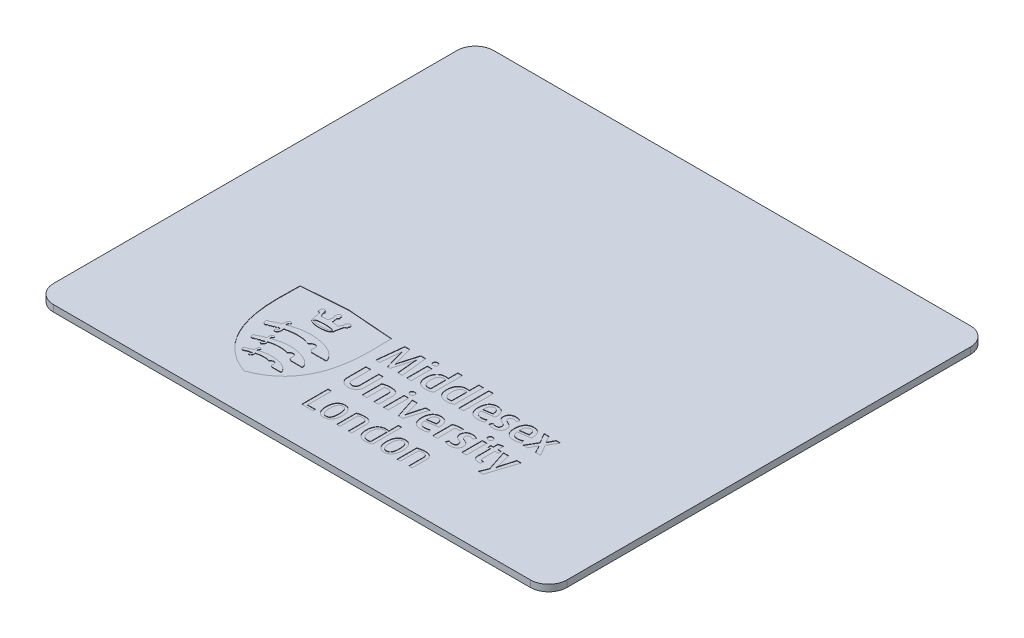
from build123d import *

# Parameters (mm, degrees)
SKETCH1_W           = 1400
SKETCH1_H           = 1200
BOSS_EXTRUDE1_DEPTH = 18
SKETCH2_R           = 5
CUT_EXTRUDE1_DEPTH  = 1
FILLET1_R           = 50
SKETCH3_W           = 12.711219773
SKETCH3_H           = 56.157817778
SKETCH3_W_2         = 12.7036033
SKETCH3_H_2         = 81.790382994
SKETCH3_W_3         = 12.708083578
SKETCH3_H_3         = 56.155353625
SKETCH3_W_4         = 12.712339843
CUT_EXTRUDE3_DEPTH  = 1
SKETCH4_R           = 50
BOSS_EXTRUDE2_DEPTH = 22


with BuildPart() as part:
    # Sketch1 → Boss-Extrude1 (new body)
    with BuildSketch(Plane(origin=(0, 0, 0), x_dir=(1, 0, 0), z_dir=(0, 1, 0))):
        Rectangle(SKETCH1_W, SKETCH1_H)
    extrude(amount=BOSS_EXTRUDE1_DEPTH)

    # Sketch2 → Cut-Extrude1 (cut)
    with BuildSketch(Plane.XZ):
        Circle(SKETCH2_R)
    extrude(amount=-CUT_EXTRUDE1_DEPTH, mode=Mode.SUBTRACT)

    # Fillet1
    fillet1_edges = [part.edges().sort_by_distance(p)[0] for p in [
        (700, 9, -600),
        (700, 9, 600),
        (-700, 9, 600),
        (-700, 9, -600),
    ]]
    fillet(fillet1_edges, radius=FILLET1_R)

    # Sketch3 → Cut-Extrude3 (cut)
    # profile 1 of 30: a face of its own
    with BuildSketch(Plane(origin=(0, 18, 0), x_dir=(1, 0, 0), z_dir=(0, 1, 0))):
        with BuildLine():
            add(Edge.make_bspline(
                [(-233.972341878, -496.795322485), (-108.060858563, -451.574758816), (-108.060858563, -246.693896228), (-108.93697686, -219.688573902)],
                knots=[4, 4, 4, 5, 5.195198766, 5.195198766, 5.195198766], degree=2))
            Line((-108.93697686, -219.688573902), (-234.732644998, -210.062025057))
            Line((-234.732644998, -210.062025057), (-358.213574782, -219.257571179))
            add(Edge.make_bspline(
                [(-358.213574782, -219.257571179), (-359.084316768, -246.258637242), (-359.084316768, -451.13949983), (-233.972341878, -496.795322485)],
                knots=[2, 2, 2, 3, 8.122573303, 8.122573303, 8.122573303], degree=2))
        make_face()
        with BuildLine():
            Line((-231.871091654, -424.034491323), (-231.323153696, -424.0389716))
            add(Edge.make_bspline(
                [(-180.634636295, -448.741655164), (-180.634636295, -443.683869582), (-189.738336493, -425.005815545), (-231.323153696, -424.0389716)],
                knots=[48, 48, 48, 48, 49, 49, 49, 49], degree=3))
            Line((-180.634636295, -448.741655164), (-180.634636295, -449.454915386))
            Line((-180.634636295, -449.454915386), (-205.346055775, -449.454915386))
            Line((-205.346055775, -449.454915386), (-210.028611333, -445.66594447))
            add(Edge.make_bspline(
                [(-212.763155447, -434.21592257), (-209.368001034, -436.007585653), (-208.326784505, -440.861966624), (-210.028611333, -445.66594447)],
                knots=[44, 44, 44, 44, 45, 45, 45, 45], degree=3))
            add(Edge.make_bspline(
                [(-223.86774765, -438.56044793), (-220.856329019, -434.342714431), (-216.196840249, -432.402306126), (-212.763155447, -434.21592257)],
                knots=[43, 43, 43, 43, 44, 44, 44, 44], degree=3))
            add(Edge.make_bspline(
                [(-223.86774765, -438.56044793), (-226.087053191, -437.781775653), (-231.272750572, -436.3115725), (-245.970525461, -436.3115725), (-253.249851044, -437.366005875), (-260.84414589, -439.439926458)],
                knots=[42, 42, 42, 42, 43, 43, 43.855672144, 43.855672144, 43.855672144, 43.855672144], degree=3))
            add(Edge.make_bspline(
                [(-260.485499654, -445.609044942), (-259.974523973, -443.528627957), (-260.075330223, -441.697538429), (-260.84414589, -439.439926458)],
                knots=[40, 40, 40, 40, 41, 41, 41, 41], degree=3))
            add(Edge.make_bspline(
                [(-264.037015847, -450.71499351), (-263.585403847, -450.443712691), (-261.302478306, -448.921090289), (-260.485499654, -445.609044942)],
                knots=[39, 39, 39, 39, 40, 40, 40, 40], degree=3))
            Line((-264.037015847, -450.71499351), (-264.276710708, -450.811319483))
            add(Edge.make_bspline(
                [(-264.276710708, -450.811319483), (-264.746915861, -451.051910399), (-265.203008139, -451.174445996), (-267.340324652, -451.174445996), (-268.70546529, -449.855228205), (-268.70546529, -446.650485511), (-267.362278013, -445.359717484), (-265.706143333, -445.337764123)],
                knots=[37, 37, 37, 37, 38, 38, 41.606953163, 41.606953163, 45.208867274, 45.208867274, 45.208867274, 45.208867274], degree=3))
            add(Edge.make_bspline(
                [(-265.460176083, -441.590459791), (-265.025813152, -443.447758943), (-265.345256958, -444.646457262), (-265.706143333, -445.337764123)],
                knots=[34, 34, 34, 34, 35, 35, 35, 35], degree=3))
            add(Edge.make_bspline(
                [(-266.021330874, -441.887950235), (-265.825542736, -441.806857207), (-265.638491138, -441.706274971), (-265.460176083, -441.590459791)],
                knots=[33, 33, 33, 33, 34, 34, 34, 34], degree=3))
            add(Edge.make_bspline(
                [(-268.901253429, -441.675585068), (-267.945386166, -442.152510638), (-266.929035152, -442.237859929), (-266.021330874, -441.887950235)],
                knots=[32, 32, 32, 32, 33, 33, 33, 33], degree=3))
            add(Edge.make_bspline(
                [(-270.788122415, -443.670876776), (-269.931717318, -443.338216151), (-269.278716832, -442.642653026), (-268.901253429, -441.675585068)],
                knots=[31, 31, 31, 31, 32, 32, 32, 32], degree=3))
            add(Edge.make_bspline(
                [(-273.677901581, -443.36464979), (-272.712177706, -443.909227554), (-271.678577623, -444.031763151), (-270.788122415, -443.670876776)],
                knots=[30, 30, 30, 30, 31, 31, 31, 31], degree=3))
            add(Edge.make_bspline(
                [(-275.547297483, -445.445066776), (-274.682155844, -445.119126567), (-274.028035289, -444.381896859), (-273.677901581, -443.36464979)],
                knots=[29, 29, 29, 29, 30, 30, 30, 30], degree=3))
            add(Edge.make_bspline(
                [(-278.456789871, -445.092692929), (-277.491065997, -445.66594447), (-276.434392483, -445.792736331), (-275.547297483, -445.445066776)],
                knots=[28, 28, 28, 28, 29, 29, 29, 29], degree=3))
            add(Edge.make_bspline(
                [(-280.304232413, -447.236729859), (-279.426097968, -446.895332692), (-278.780713955, -446.12965322), (-278.456789871, -445.092692929)],
                knots=[27, 27, 27, 27, 28, 28, 28, 28], degree=3))
            add(Edge.make_bspline(
                [(-283.225821551, -446.829696623), (-282.274210551, -447.437894331), (-281.20790444, -447.591119831), (-280.304232413, -447.236729859)],
                knots=[26, 26, 26, 26, 27, 27, 27, 27], degree=3))
            add(Edge.make_bspline(
                [(-285.052654814, -449.017416261), (-284.161079537, -448.663026289), (-283.524432064, -447.879873733), (-283.225821551, -446.829696623)],
                knots=[25, 25, 25, 25, 26, 26, 26, 26], degree=3))
            add(Edge.make_bspline(
                [(-290.122537146, -445.889062303), (-289.18839923, -448.304156039), (-286.901217425, -449.739413025), (-285.052654814, -449.017416261)],
                knots=[24, 24, 24, 24, 25, 25, 25, 25], degree=3))
            add(Edge.make_bspline(
                [(-290.171596188, -441.842027388), (-290.686828132, -443.00577954), (-290.66711491, -444.482479095), (-290.122537146, -445.889062303)],
                knots=[23, 23, 23, 23, 24, 24, 24, 24], degree=3))
            add(Edge.make_bspline(
                [(-288.486115688, -440.168419624), (-289.22760166, -440.450677124), (-289.808469674, -441.02818493), (-290.171596188, -441.842027388)],
                knots=[22, 22, 22, 22, 23, 23, 23, 23], degree=3))
            add(Edge.make_bspline(
                [(-285.816094147, -440.470390346), (-286.711925689, -439.951798194), (-287.66129655, -439.851215958), (-288.486115688, -440.168419624)],
                knots=[21, 21, 21, 21, 22, 22, 22, 22], degree=3))
            add(Edge.make_bspline(
                [(-283.868965426, -438.026622833), (-284.841409717, -438.402966166), (-285.532716578, -439.295437499), (-285.816094147, -440.470390346)],
                knots=[20, 20, 20, 20, 21, 21, 21, 21], degree=3))
            add(Edge.make_bspline(
                [(-281.211040635, -438.27819043), (-282.110232384, -437.803505), (-283.043250231, -437.709419166), (-283.868965426, -438.026622833)],
                knots=[19, 19, 19, 19, 20, 20, 20, 20], degree=3))
            add(Edge.make_bspline(
                [(-279.242182566, -435.882809917), (-280.209250524, -436.256913111), (-280.900557385, -437.120934681), (-281.211040635, -438.27819043)],
                knots=[18, 18, 18, 18, 19, 19, 19, 19], degree=3))
            add(Edge.make_bspline(
                [(-276.613827608, -436.084198403), (-277.502042677, -435.639978861), (-278.446037205, -435.56560625), (-279.242182566, -435.882809917)],
                knots=[17, 17, 17, 17, 18, 18, 18, 18], degree=3))
            add(Edge.make_bspline(
                [(-274.620776039, -433.743253265), (-275.575747247, -434.110860056), (-276.272430441, -434.944415737), (-276.613827608, -436.084198403)],
                knots=[16, 16, 16, 16, 17, 17, 17, 17], degree=3))
            add(Edge.make_bspline(
                [(-272.013254373, -433.883261945), (-272.907965845, -433.478692862), (-273.8201504, -433.432770015), (-274.620776039, -433.743253265)],
                knots=[15, 15, 15, 15, 16, 16, 16, 16], degree=3))
            add(Edge.make_bspline(
                [(-270.00496986, -431.599440349), (-270.94224397, -431.964807001), (-271.639151179, -432.767672779), (-272.013254373, -433.883261945)],
                knots=[14, 14, 14, 14, 15, 15, 15, 15], degree=3))
            add(Edge.make_bspline(
                [(-269.949190401, -431.581967265), (-269.972039818, -431.581967265), (-269.988616846, -431.594960071), (-270.00496986, -431.599440349)],
                knots=[13, 13, 13, 13, 14, 14, 14, 14], degree=3))
            add(Edge.make_bspline(
                [(-267.867653346, -421.302193921), (-268.838977568, -422.170695768), (-271.769303248, -425.430321864), (-269.949190401, -431.581967265)],
                knots=[12, 12, 12, 12, 13, 13, 13, 13], degree=3))
            add(Edge.make_bspline(
                [(-267.553585874, -421.03315324), (-267.676121471, -421.129479212), (-267.786560318, -421.225581171), (-267.867653346, -421.302193921)],
                knots=[11, 11, 11, 11, 12, 12, 12, 12], degree=3))
            add(Edge.make_bspline(
                [(-267.168730013, -420.766352698), (-267.21465286, -420.788082046), (-267.353541471, -420.87992774), (-267.553585874, -421.03315324)],
                knots=[10, 10, 10, 10, 11, 11, 11, 11], degree=3))
            Line((-267.168730013, -420.766352698), (-266.990414958, -420.68749981))
            add(Edge.make_bspline(
                [(-266.595478472, -420.527777907), (-266.754080305, -420.589157712), (-266.908425874, -420.639336824), (-266.990414958, -420.68749981)],
                knots=[8, 8, 8, 8, 9, 9, 9, 9], degree=3))
            add(Edge.make_bspline(
                [(-266.059637249, -420.42943581), (-266.224735485, -420.44041249), (-266.397450194, -420.473118518), (-266.595478472, -420.527777907)],
                knots=[7, 7, 7, 7, 8, 8, 8, 8], degree=3))
            add(Edge.make_bspline(
                [(-266.059637249, -420.42943581), (-265.96980768, -420.394265629), (-265.836295402, -420.355063199), (-263.987732792, -420.355063199), (-262.619455959, -421.672040851), (-262.619455959, -424.760968364), (-263.775591639, -425.990356586), (-265.265508014, -426.180768392)],
                knots=[6, 6, 6, 6, 7, 7, 16.915343915, 16.915343915, 26.023608912, 26.023608912, 26.023608912, 26.023608912], degree=3))
            add(Edge.make_bspline(
                [(-265.002963736, -430.719961821), (-265.974287958, -428.153882724), (-265.683293916, -427.038293558), (-265.265508014, -426.180768392)],
                knots=[3, 3, 3, 3, 4, 4, 4, 4], degree=3))
            Line((-265.002963736, -430.719961821), (-264.112508528, -430.409478571))
            add(Edge.make_bspline(
                [(-231.871091654, -424.034491323), (-246.002111419, -424.034491323), (-256.467810557, -427.718623738), (-264.112508528, -430.409478571)],
                knots=[1, 1, 1, 1, 2, 2, 2, 2], degree=3))
        make_face(mode=Mode.SUBTRACT)
        with BuildLine():
            Line((-277.780939969, -373.161161183), (-277.534748705, -373.062595072))
            add(Edge.make_bspline(
                [(-277.049086594, -372.863670738), (-277.243754663, -372.931322933), (-277.425429927, -372.994942877), (-277.534748705, -373.062595072)],
                knots=[7, 7, 7, 7, 8, 8, 8, 8], degree=3))
            add(Edge.make_bspline(
                [(-276.476955122, -372.756368086), (-276.669607066, -372.769584905), (-276.853298455, -372.806771211), (-277.049086594, -372.863670738)],
                knots=[6, 6, 6, 6, 7, 7, 7, 7], degree=3))
            add(Edge.make_bspline(
                [(-275.995773289, -372.673258933), (-276.172968275, -372.673258933), (-276.323953636, -372.716941641), (-276.476955122, -372.756368086)],
                knots=[5, 5, 5, 5, 6, 6, 6, 6], degree=3))
            add(Edge.make_bspline(
                [(-275.995773289, -372.673258933), (-274.07933447, -372.673258933), (-272.521765901, -374.16967171), (-272.521765901, -377.718051709), (-273.878169997, -379.135611598), (-275.614053622, -379.319302987)],
                knots=[4, 4, 4, 4, 5, 5, 5.933357744, 5.933357744, 5.933357744, 5.933357744], degree=3))
            add(Edge.make_bspline(
                [(-275.374582775, -384.738198958), (-276.259437636, -382.125973), (-276.048192539, -380.395689722), (-275.614053622, -379.319302987)],
                knots=[2, 2, 2, 2, 3, 3, 3, 3], degree=3))
            add(Edge.make_bspline(
                [(-275.374582775, -384.738198958), (-266.899689333, -381.747613542), (-247.062145114, -375.399059932), (-230.861685097, -375.399059932), (-230.463388412, -375.40354021), (-230.061955534, -375.414292877)],
                knots=[1, 1, 1, 1, 2, 2, 2.025408709, 2.025408709, 2.025408709, 2.025408709], degree=3))
            add(Edge.make_bspline(
                [(-162.717781905, -408.115168327), (-162.717781905, -403.050886342), (-174.420491175, -376.947891959), (-230.061955534, -375.414292877)],
                knots=[48, 48, 48, 48, 49, 49, 49, 49], degree=3))
            Line((-162.717781905, -408.115168327), (-162.717781905, -408.830444674))
            Line((-162.717781905, -408.830444674), (-195.358396794, -408.830444674))
            Line((-195.358396794, -408.830444674), (-201.559325094, -403.398555897))
            add(Edge.make_bspline(
                [(-204.542069949, -389.237965942), (-200.384596291, -391.432181984), (-199.233836973, -397.51617519), (-201.559325094, -403.398555897)],
                knots=[44, 44, 44, 44, 45, 45, 45, 45], degree=3))
            add(Edge.make_bspline(
                [(-218.128511963, -395.065911274), (-214.595364998, -389.612069137), (-208.782876771, -386.99357079), (-204.542069949, -389.237965942)],
                knots=[43, 43, 43, 43, 44, 44, 44, 44], degree=3))
            add(Edge.make_bspline(
                [(-218.128511963, -395.065911274), (-220.728417091, -394.042167802), (-228.760434872, -391.316366803), (-250.631128684, -391.316366803), (-260.348627168, -392.733926692), (-270.33852654, -395.529620024)],
                knots=[42, 42, 42, 42, 43, 43, 43.723862893, 43.723862893, 43.723862893, 43.723862893], degree=3))
            add(Edge.make_bspline(
                [(-269.988616846, -402.464417981), (-269.424101846, -400.178356245), (-269.530284429, -398.071729635), (-270.33852654, -395.529620024)],
                knots=[40, 40, 40, 40, 41, 41, 41, 41], degree=3))
            add(Edge.make_bspline(
                [(-274.151690956, -408.452085215), (-273.83336722, -408.268393827), (-270.982790484, -406.531390133), (-269.988616846, -402.464417981)],
                knots=[39, 39, 39, 39, 40, 40, 40, 40], degree=3))
            Line((-274.151690956, -408.452085215), (-274.374808789, -408.541690771))
            add(Edge.make_bspline(
                [(-274.374808789, -408.541690771), (-274.933723442, -408.830444674), (-275.458811997, -408.974933632), (-277.915348302, -408.974933632), (-279.476277079, -407.483001132), (-279.476277079, -403.801108856), (-277.915348302, -402.306936217), (-275.995773289, -402.306936217)],
                knots=[37, 37, 37, 37, 38, 38, 41.574885273, 41.574885273, 45.145423124, 45.145423124, 45.145423124, 45.145423124], degree=3))
            Line((-275.995773289, -402.306936217), (-275.949850441, -402.306936217))
            add(Edge.make_bspline(
                [(-275.485021622, -398.213978454), (-275.133767844, -400.154386759), (-275.481661414, -401.460387731), (-275.949850441, -402.306936217)],
                knots=[33, 33, 33, 33, 34, 34, 34, 34], degree=3))
            add(Edge.make_bspline(
                [(-276.442008955, -398.763036496), (-276.099715733, -398.627508093), (-275.781391997, -398.448072968), (-275.485021622, -398.213978454)],
                knots=[32, 32, 32, 32, 33, 33, 33, 33], degree=3))
            add(Edge.make_bspline(
                [(-280.07999451, -398.417383065), (-278.85822276, -399.069263482), (-277.56095833, -399.196279357), (-276.442008955, -398.763036496)],
                knots=[31, 31, 31, 31, 32, 32, 32, 32], degree=3))
            add(Edge.make_bspline(
                [(-282.446029204, -401.011911926), (-281.356649662, -400.591885884), (-280.52645419, -399.672980912), (-280.07999451, -398.417383065)],
                knots=[30, 30, 30, 30, 31, 31, 31, 31], degree=3))
            add(Edge.make_bspline(
                [(-286.102607911, -400.600622426), (-284.887332564, -401.300665828), (-283.569458856, -401.449411051), (-282.446029204, -401.011911926)],
                knots=[29, 29, 29, 29, 30, 30, 30, 30], degree=3))
            add(Edge.make_bspline(
                [(-288.445569174, -403.260787356), (-287.33759648, -402.829784634), (-286.517257619, -401.886910175), (-286.102607911, -400.600622426)],
                knots=[28, 28, 28, 28, 29, 29, 29, 29], degree=3))
            add(Edge.make_bspline(
                [(-292.179880701, -402.7598923), (-290.96034909, -403.523331633), (-289.590728174, -403.705006897), (-288.445569174, -403.260787356)],
                knots=[27, 27, 27, 27, 28, 28, 28, 28], degree=3))
            add(Edge.make_bspline(
                [(-294.441972951, -405.505406522), (-293.341616729, -405.0744038), (-292.550623687, -404.094343036), (-292.179880701, -402.7598923)],
                knots=[26, 26, 26, 26, 27, 27, 27, 27], degree=3))
            add(Edge.make_bspline(
                [(-298.199133894, -404.910201619), (-296.992595089, -405.721803938), (-295.614461645, -405.951642188), (-294.441972951, -405.505406522)],
                knots=[25, 25, 25, 25, 26, 26, 26, 26], degree=3))
            add(Edge.make_bspline(
                [(-300.448009324, -407.763018493), (-299.321443477, -407.316782827), (-298.527314241, -406.288559077), (-298.199133894, -404.910201619)],
                knots=[24, 24, 24, 24, 25, 25, 25, 25], degree=3))
            add(Edge.make_bspline(
                [(-306.588678045, -403.91714805), (-305.443519045, -406.866066883), (-302.671795199, -408.62054366), (-300.448009324, -407.763018493)],
                knots=[23, 23, 23, 23, 24, 24, 24, 24], degree=3))
            add(Edge.make_bspline(
                [(-306.652297989, -398.948968023), (-307.287825392, -400.373024315), (-307.257135489, -402.188880898), (-306.588678045, -403.91714805)],
                knots=[22, 22, 22, 22, 23, 23, 23, 23], degree=3))
            add(Edge.make_bspline(
                [(-304.631916726, -396.942923649), (-305.521251865, -397.284096802), (-306.217935059, -397.97988394), (-306.652297989, -398.948968023)],
                knots=[21, 21, 21, 21, 22, 22, 22, 22], degree=3))
            add(Edge.make_bspline(
                [(-301.197335782, -397.389159315), (-302.316285157, -396.695612316), (-303.574123143, -396.514161066), (-304.631916726, -396.942923649)],
                knots=[20, 20, 20, 20, 21, 21, 21, 21], degree=3))
            add(Edge.make_bspline(
                [(-298.806211533, -394.239076011), (-300.029103352, -394.709281163), (-300.883492324, -395.866536913), (-301.197335782, -397.389159315)],
                knots=[19, 19, 19, 19, 20, 20, 20, 20], degree=3))
            add(Edge.make_bspline(
                [(-295.44712327, -394.584729441), (-296.557336103, -393.969811316), (-297.757378505, -393.840779316), (-298.806211533, -394.239076011)],
                knots=[18, 18, 18, 18, 19, 19, 19, 19], degree=3))
            add(Edge.make_bspline(
                [(-292.972889868, -391.537244497), (-294.20227809, -392.005433525), (-295.075260214, -393.108029886), (-295.44712327, -394.584729441)],
                knots=[17, 17, 17, 17, 18, 18, 18, 18], degree=3))
            add(Edge.make_bspline(
                [(-289.658604382, -391.819501997), (-290.763440882, -391.252970873), (-291.957882937, -391.14566822), (-292.972889868, -391.537244497)],
                knots=[16, 16, 16, 16, 17, 17, 17, 17], degree=3))
            add(Edge.make_bspline(
                [(-287.158161355, -388.839893262), (-288.361339952, -389.30808229), (-289.25179516, -390.379988748), (-289.658604382, -391.819501997)],
                knots=[15, 15, 15, 15, 16, 16, 16, 16], degree=3))
            add(Edge.make_bspline(
                [(-283.852612412, -389.05001829), (-284.974921995, -388.524929734), (-286.155251175, -388.446076845), (-287.158161355, -388.839893262)],
                knots=[14, 14, 14, 14, 15, 15, 15, 15], degree=3))
            add(Edge.make_bspline(
                [(-281.335816371, -386.136045624), (-282.523762023, -386.604234651), (-283.412873148, -387.641194943), (-283.852612412, -389.05001829)],
                knots=[13, 13, 13, 13, 14, 14, 14, 14], degree=3))
            add(Edge.make_bspline(
                [(-280.922286732, -386.013510027), (-281.068791815, -386.044199929), (-281.202304093, -386.085642499), (-281.335816371, -386.136045624)],
                knots=[12, 12, 12, 12, 13, 13, 13, 13], degree=3))
            add(Edge.make_bspline(
                [(-278.510553205, -373.749645669), (-280.003605774, -375.079616127), (-283.117622842, -378.892780542), (-280.922286732, -386.013510027)],
                knots=[11, 11, 11, 11, 12, 12, 12, 12], degree=3))
            add(Edge.make_bspline(
                [(-278.182372857, -373.460891766), (-278.316781191, -373.56595428), (-278.446037205, -373.67079278), (-278.510553205, -373.749645669)],
                knots=[10, 10, 10, 10, 11, 11, 11, 11], degree=3))
            add(Edge.make_bspline(
                [(-277.780939969, -373.161161183), (-277.812525927, -373.185130669), (-277.965751427, -373.290193183), (-278.182372857, -373.460891766)],
                knots=[9, 9, 9, 9, 10, 10, 10, 10], degree=3))
        make_face(mode=Mode.SUBTRACT)
        with BuildLine():
            Line((-287.849468216, -317.47601271), (-287.603276952, -317.366469919))
            add(Edge.make_bspline(
                [(-286.980966369, -317.124758933), (-287.206324341, -317.188378877), (-287.408608883, -317.272608099), (-287.603276952, -317.366469919)],
                knots=[6, 6, 6, 6, 7, 7, 7, 7], degree=3))
            add(Edge.make_bspline(
                [(-286.315869133, -316.993486794), (-286.543467244, -317.018800363), (-286.750232064, -317.060242933), (-286.980966369, -317.124758933)],
                knots=[5, 5, 5, 5, 6, 6, 6, 6], degree=3))
            add(Edge.make_bspline(
                [(-285.751578147, -316.895144697), (-285.95162255, -316.895144697), (-286.111344453, -316.938827405), (-286.315869133, -316.993486794)],
                knots=[4, 4, 4, 4, 5, 5, 5, 5], degree=3))
            add(Edge.make_bspline(
                [(-285.751578147, -316.895144697), (-283.490605967, -316.895144697), (-281.653020037, -318.649621474), (-281.653020037, -322.854362167), (-283.301314231, -324.539842667), (-285.388451633, -324.715917584)],
                knots=[3, 3, 3, 3, 4, 4, 4.946287847, 4.946287847, 4.946287847, 4.946287847], degree=3))
            add(Edge.make_bspline(
                [(-285.259419634, -331.236289846), (-286.254713342, -328.089342736), (-285.939749814, -326.006685611), (-285.388451633, -324.715917584)],
                knots=[1, 1, 1, 1, 2, 2, 2, 2], degree=3))
            add(Edge.make_bspline(
                [(-229.552323949, -319.553069488), (-254.014410447, -319.553069488), (-276.180584747, -327.493241777), (-285.259419634, -331.236289846)],
                knots=[0, 0, 0, 0, 1, 1, 1, 1], degree=3))
            add(Edge.make_bspline(
                [(-145.536141079, -360.251912811), (-145.536141079, -353.937185299), (-160.138710068, -321.472868515), (-229.552323949, -319.553069488)],
                knots=[44, 44, 44, 44, 45, 45, 45, 45], degree=3))
            Line((-145.536141079, -360.251912811), (-145.536141079, -360.965173033))
            Line((-145.536141079, -360.965173033), (-186.103711238, -360.965173033))
            Line((-186.103711238, -360.965173033), (-192.948679453, -354.545383007))
            add(Edge.make_bspline(
                [(-195.532455581, -338.477314789), (-190.889095811, -340.932955038), (-189.82255856, -348.017618286), (-192.948679453, -354.545383007)],
                knots=[40, 40, 40, 40, 41, 41, 41, 41], degree=3))
            add(Edge.make_bspline(
                [(-209.989415546, -344.929586829), (-206.309763501, -338.982690122), (-200.068512702, -336.081710261), (-195.532455581, -338.477314789)],
                knots=[39, 39, 39, 39, 40, 40, 40, 40], degree=3))
            add(Edge.make_bspline(
                [(-209.989415546, -344.929586829), (-212.787348947, -343.770314954), (-225.701973325, -338.88524408), (-256.452577613, -338.88524408), (-267.888486638, -340.460285732), (-279.297962024, -343.560189926)],
                knots=[38, 38, 38, 38, 39, 39, 39.569510703, 39.569510703, 39.569510703, 39.569510703], degree=3))
            add(Edge.make_bspline(
                [(-278.556476052, -353.134319521), (-277.847696108, -350.246780494), (-278.100383774, -347.026580842), (-279.297962024, -343.560189926)],
                knots=[36, 36, 36, 36, 37, 37, 37, 37], degree=3))
            add(Edge.make_bspline(
                [(-283.569458856, -360.356975325), (-283.182138842, -360.133857491), (-279.75629444, -358.035743409), (-278.556476052, -353.134319521)],
                knots=[35, 35, 35, 35, 36, 36, 36, 36], degree=3))
            Line((-283.569458856, -360.356975325), (-283.842755801, -360.457557561))
            add(Edge.make_bspline(
                [(-289.842519785, -357.052546451), (-289.842519785, -359.823150228), (-286.819004328, -362.004149449), (-283.842755801, -360.457557561)],
                knots=[33, 33, 33, 33, 34, 34, 34, 34], degree=3))
            add(Edge.make_bspline(
                [(-285.751578147, -353.134319521), (-288.004709841, -353.134319521), (-289.842519785, -354.889916368), (-289.842519785, -357.052546451)],
                knots=[32, 32, 32, 32, 33, 33, 33, 33], degree=3))
            add(Edge.make_bspline(
                [(-285.612689536, -353.144176132), (-285.655252175, -353.137679729), (-285.698934883, -353.134319521), (-285.751578147, -353.134319521)],
                knots=[31, 31, 31, 31, 32, 32, 32, 32], degree=3))
            add(Edge.make_bspline(
                [(-285.23096987, -346.862378661), (-284.376580898, -350.06510523), (-284.992395078, -352.063533132), (-285.612689536, -353.144176132)],
                knots=[30, 30, 30, 30, 31, 31, 31, 31], degree=3))
            add(Edge.make_bspline(
                [(-285.928773133, -347.220128842), (-285.689078272, -347.126043009), (-285.459464036, -347.007987689), (-285.23096987, -346.862378661)],
                knots=[29, 29, 29, 29, 30, 30, 30, 30], degree=3))
            add(Edge.make_bspline(
                [(-290.298612063, -346.73670687), (-288.831769119, -347.557045731), (-287.268600202, -347.738720995), (-285.928773133, -347.220128842)],
                knots=[28, 28, 28, 28, 29, 29, 29, 29], degree=3))
            add(Edge.make_bspline(
                [(-293.106402145, -349.908743536), (-291.800401174, -349.403368202), (-290.813619993, -348.272322078), (-290.298612063, -346.73670687)],
                knots=[27, 27, 27, 27, 28, 28, 28, 28], degree=3))
            add(Edge.make_bspline(
                [(-297.506706964, -349.334595939), (-296.044344297, -350.223707063), (-294.447349284, -350.427111674), (-293.106402145, -349.908743536)],
                knots=[26, 26, 26, 26, 27, 27, 27, 27], degree=3))
            add(Edge.make_bspline(
                [(-300.285151227, -352.595118091), (-298.956076825, -352.084366424), (-297.979376269, -350.918374133), (-297.506706964, -349.334595939)],
                knots=[25, 25, 25, 25, 26, 26, 26, 26], degree=3))
            add(Edge.make_bspline(
                [(-304.716145948, -351.948614007), (-303.277752768, -352.883871993), (-301.659924463, -353.127823118), (-300.285151227, -352.595118091)],
                knots=[24, 24, 24, 24, 25, 25, 25, 25], degree=3))
            add(Edge.make_bspline(
                [(-307.451803559, -355.281492645), (-306.118472892, -354.759764298), (-305.143788462, -353.553449507), (-304.716145948, -351.948614007)],
                knots=[23, 23, 23, 23, 24, 24, 24, 24], degree=3))
            add(Edge.make_bspline(
                [(-311.951794557, -354.500580229), (-310.512281308, -355.521187506), (-308.858386766, -355.825174354), (-307.451803559, -355.281492645)],
                knots=[22, 22, 22, 22, 23, 23, 23, 23], degree=3))
            add(Edge.make_bspline(
                [(-314.624952293, -357.968091214), (-313.278628821, -357.438522381), (-312.322537543, -356.164331381), (-311.951794557, -354.500580229)],
                knots=[21, 21, 21, 21, 22, 22, 22, 22], degree=3))
            add(Edge.make_bspline(
                [(-321.804821444, -353.456003465), (-320.464994375, -356.914553895), (-317.260027667, -358.987354408), (-314.624952293, -357.968091214)],
                knots=[20, 20, 20, 20, 21, 21, 21, 21], degree=3))
            add(Edge.make_bspline(
                [(-319.547209472, -345.292937356), (-322.131881722, -346.302343939), (-323.15024886, -349.965643063), (-321.804821444, -353.456003465)],
                knots=[19, 19, 19, 19, 20, 20, 20, 20], degree=3))
            add(Edge.make_bspline(
                [(-315.413705195, -345.916368009), (-316.747035862, -345.034649342), (-318.235832167, -344.797418634), (-319.547209472, -345.292937356)],
                knots=[18, 18, 18, 18, 19, 19, 19, 19], degree=3))
            add(Edge.make_bspline(
                [(-312.57522521, -342.069377496), (-314.050804696, -342.641508968), (-315.071411973, -344.059068857), (-315.413705195, -345.916368009)],
                knots=[17, 17, 17, 17, 18, 18, 18, 18], degree=3))
            add(Edge.make_bspline(
                [(-308.512733336, -342.567136357), (-309.858160752, -341.766286704), (-311.339116571, -341.585955524), (-312.57522521, -342.069377496)],
                knots=[16, 16, 16, 16, 17, 17, 17, 17], degree=3))
            add(Edge.make_bspline(
                [(-305.604361017, -338.8339449), (-307.079940503, -339.405852358), (-308.116900794, -340.764496594), (-308.512733336, -342.567136357)],
                knots=[15, 15, 15, 15, 16, 16, 16, 16], degree=3))
            add(Edge.make_bspline(
                [(-301.592272268, -339.254866997), (-302.943076018, -338.516741233), (-304.368252379, -338.368892066), (-305.604361017, -338.8339449)],
                knots=[14, 14, 14, 14, 15, 15, 15, 15], degree=3))
            add(Edge.make_bspline(
                [(-298.633496825, -335.612625178), (-300.079506477, -336.168179622), (-301.139316185, -337.495013886), (-301.592272268, -339.254866997)],
                knots=[13, 13, 13, 13, 14, 14, 14, 14], degree=3))
            add(Edge.make_bspline(
                [(-294.655234173, -335.939685456), (-295.99842145, -335.263611539), (-297.411725075, -335.137939748), (-298.633496825, -335.612625178)],
                knots=[12, 12, 12, 12, 13, 13, 13, 13], degree=3))
            add(Edge.make_bspline(
                [(-291.762094799, -332.417515082), (-293.153445062, -332.990766623), (-294.167331923, -334.243004262), (-294.655234173, -335.939685456)],
                knots=[11, 11, 11, 11, 12, 12, 12, 12], degree=3))
            add(Edge.make_bspline(
                [(-288.732082938, -318.169335696), (-290.064517549, -319.376994571), (-294.134625895, -323.896698792), (-291.762094799, -332.417515082)],
                knots=[10, 10, 10, 10, 11, 11, 11, 11], degree=3))
            add(Edge.make_bspline(
                [(-288.297944022, -317.806209183), (-288.463042258, -317.934345127), (-288.609771355, -318.051280377), (-288.732082938, -318.169335696)],
                knots=[9, 9, 9, 9, 10, 10, 10, 10], degree=3))
            add(Edge.make_bspline(
                [(-287.849468216, -317.47601271), (-287.898751272, -317.510958877), (-288.088939063, -317.633494474), (-288.297944022, -317.806209183)],
                knots=[8, 8, 8, 8, 9, 9, 9, 9], degree=3))
        make_face(mode=Mode.SUBTRACT)
        with BuildLine():
            Line((-207.317153933, -248.296267575), (-204.312455718, -247.203527825))
            add(Edge.make_bspline(
                [(-203.809320537, -245.101381492), (-204.122043918, -245.760878381), (-204.284005955, -246.464281992), (-204.312455718, -247.203527825)],
                knots=[2, 2, 2, 2, 3, 3, 3, 3], degree=3))
            add(Edge.make_bspline(
                [(-198.775504568, -241.895294715), (-200.93029411, -241.895294715), (-202.906768601, -243.153132701), (-203.809320537, -245.101381492)],
                knots=[1, 1, 1, 1, 2, 2, 2, 2], degree=3))
            add(Edge.make_bspline(
                [(-196.432543364, -242.417023063), (-197.177389525, -242.070249563), (-197.959646005, -241.895294715), (-198.775504568, -241.895294715)],
                knots=[0, 0, 0, 0, 1, 1, 1, 1], degree=3))
            add(Edge.make_bspline(
                [(-193.750425141, -249.792680352), (-192.461897285, -247.022076575), (-193.661939657, -243.712271368), (-196.432543364, -242.417023063)],
                knots=[36, 36, 36, 36, 37, 37, 37, 37], degree=3))
            add(Edge.make_bspline(
                [(-195.041193135, -251.526323838), (-194.488767865, -251.033045255), (-194.057996202, -250.450161116), (-193.750425141, -249.792680352)],
                knots=[35, 35, 35, 35, 36, 36, 36, 36], degree=3))
            Line((-195.041193135, -251.526323838), (-193.951813622, -254.527885934))
            Line((-193.951813622, -254.527885934), (-199.527967202, -256.557899795))
            add(Edge.make_bspline(
                [(-204.391084591, -278.388277276), (-203.363084881, -272.046444083), (-201.478456082, -260.351350989), (-199.527967202, -256.557899795)],
                knots=[32, 32, 32, 32, 33, 33, 33, 33], degree=3))
            add(Edge.make_bspline(
                [(-204.928269883, -281.660000122), (-204.793637539, -280.919410206), (-204.612186294, -279.782987748), (-204.391084591, -278.388277276)],
                knots=[31, 31, 31, 31, 32, 32, 32, 32], degree=3))
            add(Edge.make_bspline(
                [(-204.928269883, -281.660000122), (-206.030866216, -287.691350065), (-217.971926259, -291.903483217), (-249.759490642, -291.903483217), (-261.999385514, -287.595024093), (-263.066811695, -281.657759983)],
                knots=[30, 30, 30, 30, 31, 31, 31.987756522, 31.987756522, 31.987756522, 31.987756522], degree=3))
            add(Edge.make_bspline(
                [(-268.44740129, -256.549163253), (-266.282755083, -261.414520905), (-263.100861806, -281.436882289), (-263.066811695, -281.657759983)],
                knots=[28, 28, 28, 28, 29, 29, 29, 29], degree=3))
            Line((-268.44740129, -256.549163253), (-273.995105247, -254.527885935))
            Line((-273.995105247, -254.527885935), (-272.910205984, -251.526323838))
            add(Edge.make_bspline(
                [(-274.196493733, -249.792680352), (-273.89676315, -250.450161116), (-273.460384095, -251.033045255), (-272.910205984, -251.526323838)],
                knots=[25, 25, 25, 25, 26, 26, 26, 26], degree=3))
            add(Edge.make_bspline(
                [(-271.516615581, -242.417023063), (-274.286099289, -243.716527632), (-275.491518025, -247.022076575), (-274.196493733, -249.792680352)],
                knots=[24, 24, 24, 24, 25, 25, 25, 25], degree=3))
            add(Edge.make_bspline(
                [(-271.516615581, -242.417023063), (-270.769529262, -242.070249563), (-269.98077636, -241.895294715), (-267.024241055, -241.895294715), (-265.048886583, -243.153132701), (-264.139838222, -245.099141354)],
                knots=[23, 23, 23, 23, 24, 24, 26.657982262, 26.657982262, 26.657982262, 26.657982262], degree=3))
            add(Edge.make_bspline(
                [(-263.641183306, -247.203527825), (-263.669633069, -246.459801714), (-263.835851375, -245.75102177), (-264.139838222, -245.099141354)],
                knots=[21, 21, 21, 21, 22, 22, 22, 22], degree=3))
            Line((-263.641183306, -247.203527825), (-260.633124806, -248.296267575))
            Line((-260.633124806, -248.296267575), (-262.632672778, -253.798272699))
            add(Edge.make_bspline(
                [(-256.03479171, -264.049596279), (-257.595496474, -261.78638396), (-260.26350189, -257.833434878), (-262.632672778, -253.798272699)],
                knots=[18, 18, 18, 18, 19, 19, 19, 19], degree=3))
            add(Edge.make_bspline(
                [(-239.645941497, -261.231949586), (-246.076484028, -261.602692572), (-251.84864417, -262.595746141), (-256.03479171, -264.049596279)],
                knots=[17, 17, 17, 17, 18, 18, 18, 18], degree=3))
            add(Edge.make_bspline(
                [(-237.424395818, -246.189640964), (-238.006383887, -252.379592741), (-239.278558729, -259.293557406), (-239.645941497, -261.231949586)],
                knots=[16, 16, 16, 16, 17, 17, 17, 17], degree=3))
            Line((-237.424395818, -246.189640964), (-241.576717157, -242.034183327))
            Line((-241.576717157, -242.034183327), (-239.322241436, -239.777691424))
            add(Edge.make_bspline(
                [(-239.322241436, -239.777691424), (-239.610995332, -239.092880966), (-239.758620481, -238.385221091), (-239.758620481, -234.602746578), (-237.266914058, -232.110144037), (-231.150438992, -232.110144037), (-228.650885912, -234.602746578), (-228.650885912, -238.389701369), (-228.798735078, -239.100721452), (-229.096231683, -239.779931563)],
                knots=[13, 13, 13, 13, 14, 14, 18.232414007, 18.232414007, 22.461728933, 22.461728933, 23.467189877, 23.467189877, 23.467189877, 23.467189877], degree=3))
            Line((-229.096231683, -239.779931563), (-226.828763158, -242.039783674))
            Line((-226.828763158, -242.039783674), (-230.980860482, -246.177544214))
            add(Edge.make_bspline(
                [(-228.787764566, -261.197899475), (-229.15313121, -259.267347781), (-230.357429846, -252.644377157), (-230.980860482, -246.177544214)],
                knots=[7, 7, 7, 7, 8, 8, 8, 8], degree=3))
            add(Edge.make_bspline(
                [(-211.926463594, -264.051612404), (-215.633438831, -262.819087988), (-223.313089275, -261.394807683), (-228.787764566, -261.197899475)],
                knots=[6, 6, 6, 6, 7, 7, 7, 7], degree=3))
            add(Edge.make_bspline(
                [(-205.316485943, -253.802528962), (-207.662807355, -257.801624906), (-210.345821634, -261.773391155), (-211.926463594, -264.051612404)],
                knots=[5, 5, 5, 5, 6, 6, 6, 6], degree=3))
            Line((-205.316485943, -253.802528962), (-207.317153933, -248.296267575))
        make_face(mode=Mode.SUBTRACT)
    # profile 2 of 30: a face of its own
    with BuildSketch(Plane(origin=(0, 18, 0), x_dir=(1, 0, 0), z_dir=(0, 1, 0))):
        with BuildLine():
            Line((-24.84528999, -235.799428773), (-24.635400302, -235.799428773))
            add(Edge.make_bspline(
                [(-24.322452908, -244.449501076), (-24.733742397, -239.965863091), (-24.635400302, -235.799428773)],
                knots=[1, 1, 1, 2, 2, 2], degree=2))
            add(Edge.make_bspline(
                [(-19.740472941, -291.855544245), (-19.840159119, -290.086730578), (-24.322452908, -244.449501076)],
                knots=[0, 0, 0, 1, 1, 1], degree=2))
            Line((-19.740472941, -291.855544245), (-7.230417635, -291.855544245))
            Line((-7.230417635, -291.855544245), (-15.257059083, -220.172219888))
            Line((-15.257059083, -220.172219888), (-28.598205896, -220.172219888))
            Line((-28.598205896, -220.172219888), (-41.8246576, -266.121276723))
            add(Edge.make_bspline(
                [(-43.700539013, -274.144334152), (-43.178821524, -270.702136736), (-41.8246576, -266.121276723)],
                knots=[17, 17, 17, 18, 18, 18], degree=2))
            Line((-43.700539013, -274.144334152), (-43.909554811, -274.144334152))
            add(Edge.make_bspline(
                [(-45.78208686, -266.121276723), (-44.53948185, -270.702136736), (-43.909554811, -274.144334152)],
                knots=[15, 15, 15, 16, 16, 16], degree=2))
            Line((-45.78208686, -266.121276723), (-58.604865547, -220.172219888))
            Line((-58.604865547, -220.172219888), (-71.94086004, -220.172219888))
            Line((-71.94086004, -220.172219888), (-79.962797196, -291.855544245))
            Line((-79.962797196, -291.855544245), (-68.808015674, -291.855544245))
            add(Edge.make_bspline(
                [(-64.226045917, -244.343318493), (-68.70856372, -289.77288712), (-68.808015674, -291.855544245)],
                knots=[10, 10, 10, 11, 11, 11], degree=2))
            add(Edge.make_bspline(
                [(-63.914442606, -235.799428773), (-63.813636358, -239.863040716), (-64.226045917, -244.343318493)],
                knots=[9, 9, 9, 10, 10, 10], degree=2))
            Line((-63.914442606, -235.799428773), (-63.706557722, -235.799428773))
            add(Edge.make_bspline(
                [(-61.618524317, -244.343318493), (-62.86762573, -239.863040716), (-63.706557722, -235.799428773)],
                knots=[7, 7, 7, 8, 8, 8], degree=2))
            add(Edge.make_bspline(
                [(-48.079125218, -291.855544245), (-48.804258158, -289.77288712), (-61.618524317, -244.343318493)],
                knots=[6, 6, 6, 7, 7, 7], degree=2))
            Line((-48.079125218, -291.855544245), (-40.578916396, -291.855544245))
            add(Edge.make_bspline(
                [(-26.92258205, -244.449501076), (-39.742000528, -289.462179856), (-40.578916396, -291.855544245)],
                knots=[4, 4, 4, 5, 5, 5], degree=2))
            add(Edge.make_bspline(
                [(-24.84528999, -235.799428773), (-25.57155432, -239.863040716), (-26.92258205, -244.449501076)],
                knots=[3, 3, 3, 4, 4, 4], degree=2))
        make_face()
    # profile 3 of 30: a face of its own
    with BuildSketch(Plane(origin=(0, 18, 0), x_dir=(1, 0, 0), z_dir=(0, 1, 0))):
        with Locations((11.107918876, -263.776635356)):
            Rectangle(SKETCH3_W, SKETCH3_H)
    # profile 4 of 30: a face of its own
    with BuildSketch(Plane(origin=(0, 18, 0), x_dir=(1, 0, 0), z_dir=(0, 1, 0))):
        with BuildLine():
            Line((62.36912777, -210.065161251), (62.36912777, -236.217438689))
            add(Edge.make_bspline(
                [(62.36912777, -236.217438689), (59.872941069, -235.489841578), (57.064030988, -235.17487805), (39.344308815, -235.17487805), (29.342312946, -246.117508492), (29.342312946, -282.271334025), (38.924282784, -292.899000939), (64.243899958, -292.899000939), (70.601189949, -291.338072161), (75.081467612, -288.836509065)],
                knots=[2, 2, 2, 2, 3, 3, 7.664232009, 7.664232009, 12.196323598, 12.196323598, 14.589787556, 14.589787556, 14.589787556, 14.589787556], degree=3))
            Line((75.081467612, -288.836509065), (75.081467612, -210.065161251))
            Line((75.081467612, -210.065161251), (62.36912777, -210.065161251))
        make_face()
        with BuildLine():
            Line((62.36912777, -243.094217048), (62.36912777, -283.518419344))
            add(Edge.make_bspline(
                [(62.36912777, -283.518419344), (60.914381612, -284.460173733), (58.822987999, -284.772001066), (46.016562326, -284.772001066), (41.945334013, -276.437116304), (41.945334013, -251.845767644), (45.69487839, -242.365723882), (58.726662029, -242.365723882), (60.599194079, -242.572488701), (62.36912777, -243.094217048)],
                knots=[3, 3, 3, 3, 4, 4, 7.254204495, 7.254204495, 10.29608475, 10.29608475, 10.841731194, 10.841731194, 10.841731194, 10.841731194], degree=3))
        make_face(mode=Mode.SUBTRACT)
    # profile 5 of 30: a face of its own
    with BuildSketch(Plane(origin=(0, 18, 0), x_dir=(1, 0, 0), z_dir=(0, 1, 0))):
        with BuildLine():
            Line((119.57577713, -210.065161251), (119.57577713, -236.217438689))
            add(Edge.make_bspline(
                [(119.57577713, -236.217438689), (117.075334166, -235.489841578), (114.257687543, -235.17487805), (96.546477898, -235.17487805), (86.544706042, -246.117508492), (86.544706042, -282.271334025), (96.130932144, -292.899000939), (121.452789457, -292.899000939), (127.807839309, -291.338072161), (132.290357111, -288.836509065)],
                knots=[2, 2, 2, 2, 3, 3, 7.665567897, 7.665567897, 12.198957528, 12.198957528, 14.591940676, 14.591940676, 14.591940676, 14.591940676], degree=3))
            Line((132.290357111, -288.836509065), (132.290357111, -210.065161251))
            Line((132.290357111, -210.065161251), (119.57577713, -210.065161251))
        make_face()
        with BuildLine():
            Line((119.57577713, -243.094217048), (119.57577713, -283.518419344))
            add(Edge.make_bspline(
                [(119.57577713, -283.518419344), (118.107814153, -284.460173733), (116.033893623, -284.772001066), (103.207978742, -284.772001066), (99.154223512, -276.437116304), (99.154223512, -251.845767644), (102.903767888, -242.365723882), (115.915838306, -242.365723882), (117.808083578, -242.572488701), (119.57577713, -243.094217048)],
                knots=[3, 3, 3, 3, 4, 4, 7.236403996, 7.236403996, 10.261645165, 10.261645165, 10.801000678, 10.801000678, 10.801000678, 10.801000678], degree=3))
        make_face(mode=Mode.SUBTRACT)
    # profile 6 of 30: a face of its own
    with BuildSketch(Plane(origin=(0, 18, 0), x_dir=(1, 0, 0), z_dir=(0, 1, 0))):
        with Locations((153.321116484, -250.960352748)):
            Rectangle(SKETCH3_W_2, SKETCH3_H_2)
    # profile 7 of 30: a face of its own
    with BuildSketch(Plane(origin=(0, 18, 0), x_dir=(1, 0, 0), z_dir=(0, 1, 0))):
        with BuildLine():
            Line((216.249657866, -288.93933144), (213.226349088, -280.917394081))
            add(Edge.make_bspline(
                [(213.226349088, -280.917394081), (210.209554123, -282.480338983), (205.517152452, -284.039027622), (189.783520227, -284.039027622), (184.778154022, -278.833616887), (183.743433895, -268.414954931)],
                knots=[1, 1, 1, 1, 2, 2, 3.43465371, 3.43465371, 3.43465371, 3.43465371], degree=3))
            Line((183.743433895, -268.414954931), (218.124412643, -263.414068877))
            add(Edge.make_bspline(
                [(218.124412643, -263.414068877), (218.642780769, -244.553219506), (210.51802124, -234.653149703), (180.93026755, -234.653149703), (171.652508565, -245.282832742), (171.652508565, -282.584281427), (181.763599196, -292.899000939), (206.249884724, -292.899000939), (212.289971056, -291.127051078), (216.249657866, -288.93933144)],
                knots=[6, 6, 6, 6, 7, 7, 7.987510345, 7.987510345, 9.008701306, 9.008701306, 9.556289179, 9.556289179, 9.556289179, 9.556289179], degree=3))
        make_face()
        with BuildLine():
            Line((206.249884724, -258.410942684), (183.019437597, -261.953722335))
            add(Edge.make_bspline(
                [(183.019437597, -261.953722335), (182.704457505, -248.512889005), (187.810405944, -242.466306118), (202.183136689, -242.466306118), (206.249884724, -247.054782603), (206.249884724, -258.410942684)],
                knots=[0, 0, 0, 0, 1, 1, 1.944949679, 1.944949679, 1.944949679, 1.944949679], degree=3))
        make_face(mode=Mode.SUBTRACT)
    # profile 8 of 30: a face of its own
    with BuildSketch(Plane(origin=(0, 18, 0), x_dir=(1, 0, 0), z_dir=(0, 1, 0))):
        with BuildLine():
            Line((229.261710873, -280.603326609), (225.914495431, -288.729430426))
            add(Edge.make_bspline(
                [(225.914495431, -288.729430426), (229.261710873, -291.024228703), (234.881771174, -292.795058494), (253.736795707, -292.795058494), (261.45048976, -284.875719496), (261.45048976, -269.144568167), (258.952286935, -263.516891252), (248.007416631, -259.13943585)],
                knots=[0, 0, 0, 0, 1, 1, 2.872066082, 2.872066082, 4.210980621, 4.210980621, 4.210980621, 4.210980621], degree=3))
            add(Edge.make_bspline(
                [(248.007416631, -259.13943585), (243.113833353, -257.157360962), (239.674790221, -254.866818948), (239.674790221, -246.326289437), (242.4836823, -242.88633216), (251.658618913, -242.88633216), (254.9968738, -244.655145826), (256.66400355, -246.012445978)],
                knots=[11, 11, 11, 11, 12, 12, 12.86266367, 12.86266367, 13.517632086, 13.517632086, 13.517632086, 13.517632086], degree=3))
            Line((256.66400355, -246.012445978), (259.78561858, -238.611699133))
            add(Edge.make_bspline(
                [(259.78561858, -238.611699133), (256.125903771, -236.217438689), (251.444237627, -234.653149703), (234.459505004, -234.653149703), (227.382458407, -241.947937979), (227.382458407, -256.747191531), (229.567937851, -262.579393127), (240.191124219, -266.64412514)],
                knots=[7, 7, 7, 7, 8, 8, 9.71843964, 9.71843964, 10.837536464, 10.837536464, 10.837536464, 10.837536464], degree=3))
            add(Edge.make_bspline(
                [(240.191124219, -266.64412514), (245.922743434, -268.829604639), (248.420946259, -271.121042708), (248.420946259, -280.498264095), (244.986365402, -283.835623011), (235.196752584, -283.835623011), (231.344367945, -282.271334025), (229.261710873, -280.603326609)],
                knots=[4, 4, 4, 4, 5, 5, 5.956806283, 5.956806283, 6.799815554, 6.799815554, 6.799815554, 6.799815554], degree=3))
        make_face()
    # profile 9 of 30: a face of its own
    with BuildSketch(Plane(origin=(0, 18, 0), x_dir=(1, 0, 0), z_dir=(0, 1, 0))):
        with BuildLine():
            Line((315.12197603, -288.93933144), (312.098684662, -280.917394081))
            add(Edge.make_bspline(
                [(312.098684662, -280.917394081), (309.070913017, -282.480338983), (304.38275047, -284.039027622), (288.655855802, -284.039027622), (283.657210013, -278.833616887), (282.618009609, -268.414954931)],
                knots=[1, 1, 1, 1, 2, 2, 3.433709279, 3.433709279, 3.433709279, 3.433709279], degree=3))
            Line((282.618009609, -268.414954931), (316.988011677, -263.414068877))
            add(Edge.make_bspline(
                [(316.988011677, -263.414068877), (317.515136313, -244.553219506), (309.388116676, -234.653149703), (279.791626445, -234.653149703), (270.527084279, -245.282832742), (270.527084279, -282.584281427), (280.631678507, -292.899000939), (305.111243618, -292.899000939), (311.162306631, -291.127051078), (315.12197603, -288.93933144)],
                knots=[6, 6, 6, 6, 7, 7, 7.985468043, 7.985468043, 9.004547046, 9.004547046, 9.550594761, 9.550594761, 9.550594761, 9.550594761], degree=3))
        make_face()
        with BuildLine():
            Line((305.111243618, -258.410942684), (281.883020058, -261.953722335))
            add(Edge.make_bspline(
                [(281.883020058, -261.953722335), (281.5658164, -248.512889005), (286.667284561, -242.466306118), (301.053232125, -242.466306118), (305.111243618, -247.054782603), (305.111243618, -258.410942684)],
                knots=[0, 0, 0, 0, 1, 1, 1.942674774, 1.942674774, 1.942674774, 1.942674774], degree=3))
        make_face(mode=Mode.SUBTRACT)
    # profile 10 of 30: a face of its own
    with BuildSketch(Plane(origin=(0, 18, 0), x_dir=(1, 0, 0), z_dir=(0, 1, 0))):
        Polygon((345.527828421, -271.434886166), (356.054688819, -291.855544245), (370.01187381, -291.855544245), (352.407966815, -261.954842405), (368.338266089, -235.697726467), (356.363155936, -235.697726467), (346.466446591, -254.033487282), (346.260801846, -254.033487282), (336.783894519, -235.697726467), (323.439387498, -235.697726467), (339.072196335, -262.789518155), (321.667437682, -291.855544245), (334.58318213, -291.855544245), (345.324423815, -271.434886166), align=None)
    # profile 11 of 30: a face of its own
    with BuildSketch(Plane(origin=(0, 18, 0), x_dir=(1, 0, 0), z_dir=(0, 1, 0))):
        with BuildLine():
            Line((-77.361771999, -320.895136696), (-77.361771999, -371.736880877))
            add(Edge.make_bspline(
                [(-77.361771999, -371.736880877), (-77.361771999, -384.759928305), (-67.769049494, -393.724964136), (-39.637162031, -393.724964136), (-30.051831984, -384.759928305), (-30.051831984, -371.736880877)],
                knots=[0, 0, 0, 0, 1, 1, 2.000366365, 2.000366365, 2.000366365, 2.000366365], degree=3))
            Line((-30.051831984, -371.736880877), (-30.051831984, -320.895136696))
            Line((-30.051831984, -320.895136696), (-42.344369809, -320.895136696))
            Line((-42.344369809, -320.895136696), (-42.344369809, -371.636298641))
            add(Edge.make_bspline(
                [(-42.344369809, -371.636298641), (-42.344369809, -379.345512612), (-47.140731061, -383.510826861), (-59.115841214, -383.510826861), (-64.123223545, -379.345512612), (-64.123223545, -371.636298641)],
                knots=[5, 5, 5, 5, 6, 6, 6.982973514, 6.982973514, 6.982973514, 6.982973514], degree=3))
            Line((-64.123223545, -371.636298641), (-64.123223545, -320.895136696))
            Line((-64.123223545, -320.895136696), (-77.361771999, -320.895136696))
        make_face()
    # profile 12 of 30: a face of its own
    with BuildSketch(Plane(origin=(0, 18, 0), x_dir=(1, 0, 0), z_dir=(0, 1, 0))):
        with BuildLine():
            Line((15.689338808, -352.779033493), (15.689338808, -392.576444928))
            Line((15.689338808, -392.576444928), (28.403918789, -392.576444928))
            Line((28.403918789, -392.576444928), (28.403918789, -352.568908466))
            add(Edge.make_bspline(
                [(28.403918789, -352.568908466), (28.403918789, -343.504410468), (22.880184458, -335.383906998), (-3.379170956, -335.383906998), (-10.568884855, -336.943715706), (-15.88048972, -339.441918594)],
                knots=[7, 7, 7, 7, 8, 8, 8.565506557, 8.565506557, 8.565506557, 8.565506557], degree=3))
            Line((-15.88048972, -339.441918594), (-15.88048972, -392.576444928))
            Line((-15.88048972, -392.576444928), (-3.168149878, -392.576444928))
            Line((-3.168149878, -392.576444928), (-3.168149878, -344.967893204))
            add(Edge.make_bspline(
                [(-3.168149878, -344.967893204), (-0.770517357, -344.02300262), (1.416070228, -343.402708162), (13.602425472, -343.402708162), (15.689338808, -348.194813272), (15.689338808, -352.779033493)],
                knots=[2, 2, 2, 2, 3, 3, 4.921903534, 4.921903534, 4.921903534, 4.921903534], degree=3))
        make_face()
    # profile 13 of 30: a face of its own
    with BuildSketch(Plane(origin=(0, 18, 0), x_dir=(1, 0, 0), z_dir=(0, 1, 0))):
        with Locations((48.719401833, -364.494287837)):
            Rectangle(SKETCH3_W_3, SKETCH3_H_3)
    # profile 14 of 30: a face of its own
    with BuildSketch(Plane(origin=(0, 18, 0), x_dir=(1, 0, 0), z_dir=(0, 1, 0))):
        with BuildLine():
            Line((82.790681388, -392.576444928), (94.879590593, -392.576444928))
            Line((94.879590593, -392.576444928), (112.90128348, -336.41974722))
            Line((112.90128348, -336.41974722), (101.020259159, -336.41974722))
            Line((101.020259159, -336.41974722), (90.919921194, -372.679755336))
            add(Edge.make_bspline(
                [(89.458678634, -380.386953181), (89.777898418, -376.847309723), (90.919921194, -372.679755336)],
                knots=[6, 6, 6, 7, 7, 7], degree=2))
            Line((89.458678634, -380.386953181), (89.253033889, -380.386953181))
            add(Edge.make_bspline(
                [(87.892149549, -372.679755336), (89.045149006, -376.744487348), (89.253033889, -380.386953181)],
                knots=[4, 4, 4, 5, 5, 5], degree=2))
            Line((87.892149549, -372.679755336), (77.999696468, -336.41974722))
            Line((77.999696468, -336.41974722), (64.45402498, -336.41974722))
            Line((64.45402498, -336.41974722), (82.790681388, -392.576444928))
        make_face()
    # profile 15 of 30: a face of its own
    with BuildSketch(Plane(origin=(0, 18, 0), x_dir=(1, 0, 0), z_dir=(0, 1, 0))):
        with BuildLine():
            Line((162.901854247, -389.662472262), (159.874322602, -381.644791167))
            add(Edge.make_bspline(
                [(159.874322602, -381.644791167), (156.850791234, -383.204599875), (152.160612562, -384.759928305), (136.429237616, -384.759928305), (131.430591827, -379.557877778), (130.391391423, -369.133615475)],
                knots=[1, 1, 1, 1, 2, 2, 3.434310871, 3.434310871, 3.434310871, 3.434310871], degree=3))
            Line((130.391391423, -369.133615475), (164.770130032, -364.137209699))
            add(Edge.make_bspline(
                [(164.770130032, -364.137209699), (165.295218574, -345.278600467), (157.161514409, -335.381666859), (127.567248398, -335.381666859), (118.300466093, -346.00283737), (118.300466093, -383.305182111), (128.40730046, -393.619901622), (152.895602113, -393.619901622), (158.933464269, -391.8501919), (162.901854247, -389.662472262)],
                knots=[6, 6, 6, 6, 7, 7, 7.985913593, 7.985913593, 9.005281051, 9.005281051, 9.552460387, 9.552460387, 9.552460387, 9.552460387], degree=3))
        make_face()
        with BuildLine():
            Line((152.895602113, -359.136099631), (129.662898275, -362.677983227))
            add(Edge.make_bspline(
                [(129.662898275, -362.677983227), (129.339198214, -349.236029827), (134.449402917, -343.192807148), (148.83535048, -343.192807148), (152.895602113, -347.780163564), (152.895602113, -359.136099631)],
                knots=[0, 0, 0, 0, 1, 1, 1.943258549, 1.943258549, 1.943258549, 1.943258549], degree=3))
        make_face(mode=Mode.SUBTRACT)
    # profile 16 of 30: a face of its own
    with BuildSketch(Plane(origin=(0, 18, 0), x_dir=(1, 0, 0), z_dir=(0, 1, 0))):
        with BuildLine():
            Line((189.050770816, -392.576444928), (189.050770816, -345.170401759))
            add(Edge.make_bspline(
                [(200.92731486, -344.75687212), (196.657162219, -343.301005857), (191.97123981, -343.504410468), (189.050770816, -345.170401759)],
                knots=[0, 0, 0, 0, 1, 1, 1, 1], degree=3))
            Line((200.92731486, -344.75687212), (203.43447824, -335.4791129))
            add(Edge.make_bspline(
                [(176.336190834, -339.441022538), (182.166152144, -336.627632108), (189.25641556, -335.062447067), (203.43447824, -335.4791129)],
                knots=[4, 4, 4, 4, 5, 5, 5, 5], degree=3))
            Line((176.336190834, -339.441022538), (176.336190834, -392.576444928))
            Line((176.336190834, -392.576444928), (189.050770816, -392.576444928))
        make_face()
    # profile 17 of 30: a face of its own
    with BuildSketch(Plane(origin=(0, 18, 0), x_dir=(1, 0, 0), z_dir=(0, 1, 0))):
        with BuildLine():
            Line((211.651083461, -381.3275875), (208.321565116, -389.456827512))
            add(Edge.make_bspline(
                [(208.321565116, -389.456827512), (211.651083461, -391.736392845), (217.284360581, -393.517079247), (236.141849267, -393.517079247), (243.853079167, -385.597740249), (243.853079167, -369.873085322), (241.352654249, -364.242048199), (230.416726455, -359.858096394)],
                knots=[0, 0, 0, 0, 1, 1, 2.874312835, 2.874312835, 4.215391501, 4.215391501, 4.215391501, 4.215391501], degree=3))
            add(Edge.make_bspline(
                [(230.416726455, -359.858096394), (225.51642276, -357.882741923), (222.086098167, -355.592199909), (222.086098167, -347.048310189), (224.888511846, -343.611713121), (234.063448459, -343.611713121), (237.406183624, -345.379182703), (239.064334387, -346.737826939)],
                knots=[11, 11, 11, 11, 12, 12, 12.862850444, 12.862850444, 13.519205814, 13.519205814, 13.519205814, 13.519205814], degree=3))
            Line((239.064334387, -346.737826939), (242.181711585, -339.339096219))
            add(Edge.make_bspline(
                [(242.181711585, -339.339096219), (238.53722972, -336.941475567), (233.85354745, -335.383906998), (216.870830953, -335.383906998), (209.783031689, -342.666598524), (209.783031689, -357.472572492), (211.970527259, -363.30141388), (222.600210029, -367.361665615)],
                knots=[7, 7, 7, 7, 8, 8, 9.716266571, 9.716266571, 10.83381855, 10.83381855, 10.83381855, 10.83381855], degree=3))
            add(Edge.make_bspline(
                [(222.600210029, -367.361665615), (228.32757298, -369.553641517), (230.832272208, -371.846423669), (230.832272208, -381.224765125), (227.38895481, -384.556523694), (217.60156424, -384.556523694), (213.738220811, -382.998955125), (211.651083461, -381.3275875)],
                knots=[4, 4, 4, 4, 5, 5, 5.957589077, 5.957589077, 6.80010431, 6.80010431, 6.80010431, 6.80010431], degree=3))
        make_face()
    # profile 18 of 30: a face of its own
    with BuildSketch(Plane(origin=(0, 18, 0), x_dir=(1, 0, 0), z_dir=(0, 1, 0))):
        with Locations((261.777550029, -364.494287837)):
            Rectangle(SKETCH3_W_4, SKETCH3_H_3)
    # profile 19 of 30: a face of its own
    with BuildSketch(Plane(origin=(0, 18, 0), x_dir=(1, 0, 0), z_dir=(0, 1, 0))):
        with BuildLine():
            Line((285.322100349, -344.546747093), (285.322100349, -377.989332529))
            add(Edge.make_bspline(
                [(285.322100349, -377.989332529), (285.322100349, -385.807865277), (289.697296345, -393.202115719), (303.763800111, -393.202115719), (306.056358192, -392.576444928), (307.202637232, -392.053596511)],
                knots=[0, 0, 0, 0, 1, 1, 1.272762283, 1.272762283, 1.272762283, 1.272762283], degree=3))
            Line((307.202637232, -392.053596511), (307.202637232, -384.142994055))
            add(Edge.make_bspline(
                [(307.202637232, -384.142994055), (306.167917105, -384.45146118), (305.330105182, -384.659346069), (299.80861099, -384.659346069), (298.043157577, -381.747613542), (298.043157577, -377.367918001)],
                knots=[13, 13, 13, 13, 14, 14, 17.816884893, 17.816884893, 17.816884893, 17.816884893], degree=3))
            Line((298.043157577, -377.367918001), (298.043157577, -344.546747093))
            Line((298.043157577, -344.546747093), (307.202637232, -344.546747093))
            Line((307.202637232, -344.546747093), (307.202637232, -336.416611025))
            Line((307.202637232, -336.416611025), (298.043157577, -336.416611025))
            Line((298.043157577, -336.416611025), (298.043157577, -320.478470862))
            Line((298.043157577, -320.478470862), (285.322100349, -324.01811432))
            Line((285.322100349, -324.01811432), (285.322100349, -336.416611025))
            Line((285.322100349, -336.416611025), (279.078366241, -336.416611025))
            Line((279.078366241, -336.416611025), (279.078366241, -344.546747093))
            Line((279.078366241, -344.546747093), (285.322100349, -344.546747093))
        make_face()
    # profile 20 of 30: a face of its own
    with BuildSketch(Plane(origin=(0, 18, 0), x_dir=(1, 0, 0), z_dir=(0, 1, 0))):
        with BuildLine():
            Line((322.630025338, -414.977833811), (336.072874454, -414.977833811))
            Line((336.072874454, -414.977833811), (361.701182758, -336.41862715))
            Line((361.701182758, -336.41862715), (349.822174561, -336.41862715))
            Line((349.822174561, -336.41862715), (339.391640133, -372.78257771))
            add(Edge.make_bspline(
                [(337.840568006, -380.808995347), (338.157771664, -377.162273251), (339.391640133, -372.78257771)],
                knots=[7, 7, 7, 8, 8, 8], degree=2))
            Line((337.840568006, -380.808995347), (337.630442983, -380.808995347))
            add(Edge.make_bspline(
                [(336.486404082, -372.78257771), (337.630442983, -377.162273251), (337.630442983, -380.808995347)],
                knots=[5, 5, 5, 6, 6, 6], degree=2))
            Line((336.486404082, -372.78257771), (326.801835885, -336.41862715))
            Line((326.801835885, -336.41862715), (313.247203841, -336.41862715))
            Line((313.247203841, -336.41862715), (331.796021726, -392.57196465))
            Line((331.796021726, -392.57196465), (322.630025338, -414.977833811))
        make_face()
    # profile 21 of 30: a face of its own
    with BuildSketch(Plane(origin=(0, 18, 0), x_dir=(1, 0, 0), z_dir=(0, 1, 0))):
        Polygon((-76.417767477, -425.097885253), (-76.417767477, -496.775609263), (-45.262598665, -496.775609263), (-45.262598665, -490.315496737), (-66.833791531, -490.315496737), (-66.833791531, -425.097885253), align=None)
    # profile 22 of 30: a face of its own
    with BuildSketch(Plane(origin=(0, 18, 0), x_dir=(1, 0, 0), z_dir=(0, 1, 0))):
        with BuildLine():
            Line((50.284698842, -456.453109273), (50.284698842, -496.775609263))
            Line((50.284698842, -496.775609263), (59.457395316, -496.775609263))
            Line((59.457395316, -496.775609263), (59.457395316, -456.249704662))
            add(Edge.make_bspline(
                [(59.457395316, -456.249704662), (59.457395316, -448.225527164), (54.858851656, -439.577694999), (30.278690977, -439.577694999), (23.717996381, -441.137503707), (18.714870314, -443.528627957)],
                knots=[7, 7, 7, 7, 8, 8, 8.574102541, 8.574102541, 8.574102541, 8.574102541], degree=3))
            Line((18.714870314, -443.528627957), (18.714870314, -496.775609263))
            Line((18.714870314, -496.775609263), (27.881070386, -496.775609263))
            Line((27.881070386, -496.775609263), (27.881070386, -447.497033997))
            add(Edge.make_bspline(
                [(27.881070386, -447.497033997), (30.801539381, -446.245692414), (33.306475412, -445.514959109), (48.099219398, -445.514959109), (50.284698842, -451.24433833), (50.284698842, -456.453109273)],
                knots=[2, 2, 2, 2, 3, 3, 4.843644185, 4.843644185, 4.843644185, 4.843644185], degree=3))
        make_face()
    # profile 23 of 30: a face of its own
    with BuildSketch(Plane(origin=(0, 18, 0), x_dir=(1, 0, 0), z_dir=(0, 1, 0))):
        with BuildLine():
            Line((105.292651939, -414.982090075), (105.292651939, -441.343148457))
            add(Edge.make_bspline(
                [(105.292651939, -441.343148457), (102.273840849, -440.516313194), (99.558792585, -440.091806874), (81.955109603, -440.091806874), (72.058176245, -450.93385508), (72.058176245, -486.568192404), (80.712504593, -497.825786374), (104.566398929, -497.825786374), (110.6087254, -496.154418749), (114.360509915, -493.866116875)],
                knots=[2, 2, 2, 2, 3, 3, 7.635209753, 7.635209753, 11.857693061, 11.857693061, 13.91649433, 13.91649433, 13.91649433, 13.91649433], degree=3))
            Line((114.360509915, -493.866116875), (114.360509915, -414.982090075))
            Line((114.360509915, -414.982090075), (105.292651939, -414.982090075))
        make_face()
        with BuildLine():
            Line((105.292651939, -446.449097025), (105.292651939, -490.214914501))
            add(Edge.make_bspline(
                [(105.292651939, -490.214914501), (103.520702123, -491.36119357), (100.92169305, -491.774723209), (85.706894119, -491.774723209), (81.125810208, -482.085674489), (81.125810208, -456.656513884), (85.293378593, -445.40788047), (100.711792041, -445.40788047), (103.004350122, -445.827906512), (105.292651939, -446.449097025)],
                knots=[3, 3, 3, 3, 4, 4, 7.053171809, 7.053171809, 9.866149606, 9.866149606, 10.385271775, 10.385271775, 10.385271775, 10.385271775], degree=3))
        make_face(mode=Mode.SUBTRACT)
    # profile 24 of 30: a face of its own
    with BuildSketch(Plane(origin=(0, 18, 0), x_dir=(1, 0, 0), z_dir=(0, 1, 0))):
        with BuildLine():
            Line((215.011291709, -456.453109273), (215.011291709, -496.775609263))
            Line((215.011291709, -496.775609263), (224.186228322, -496.775609263))
            Line((224.186228322, -496.775609263), (224.186228322, -456.249704662))
            add(Edge.make_bspline(
                [(224.186228322, -456.249704662), (224.186228322, -448.225527164), (219.596631883, -439.577694999), (195.003267719, -439.577694999), (188.449069525, -441.137503707), (183.448183597, -443.528627957)],
                knots=[7, 7, 7, 7, 8, 8, 8.573617521, 8.573617521, 8.573617521, 8.573617521], degree=3))
            Line((183.448183597, -443.528627957), (183.448183597, -496.775609263))
            Line((183.448183597, -496.775609263), (192.609903391, -496.775609263))
            Line((192.609903391, -496.775609263), (192.609903391, -447.497033997))
            add(Edge.make_bspline(
                [(192.609903391, -447.497033997), (195.528373149, -446.245692414), (198.031039364, -445.514959109), (212.828052403, -445.514959109), (215.011291709, -451.24433833), (215.011291709, -456.453109273)],
                knots=[2, 2, 2, 2, 3, 3, 4.837249259, 4.837249259, 4.837249259, 4.837249259], degree=3))
        make_face()
    # profile 25 of 30: a face of its own
    with BuildSketch(Plane(origin=(0, 18, 0), x_dir=(1, 0, 0), z_dir=(0, 1, 0))):
        with BuildLine():
            add(Edge.make_bspline(
                [(11.11071905, -213.400280028), (7.253872023, -213.400280028), (4.129774408, -216.21031025), (4.129774408, -223.192151123), (7.253872023, -226.006437608), (15.072404574, -226.006437608), (18.089211943, -223.192151123), (18.089211943, -216.21031025), (15.072404574, -213.400280028), (11.11071905, -213.400280028)],
                knots=[0, 0, 0, 0, 1.031482206, 1.031482206, 2.031482206, 2.031482206, 3.058664642, 3.058664642, 4.118185046, 4.118185046, 4.118185046, 4.118185046], degree=3))
        make_face()
    # profile 26 of 30: a face of its own
    with BuildSketch(Plane(origin=(0, 18, 0), x_dir=(1, 0, 0), z_dir=(0, 1, 0))):
        with BuildLine():
            add(Edge.make_bspline(
                [(48.722650034, -314.121180711), (44.872312492, -314.121180711), (41.737449129, -316.937707336), (41.737449129, -323.918652153), (44.872312492, -326.7306985), (52.688815836, -326.7306985), (55.69890374, -323.918652153), (55.69890374, -316.937707336), (52.688815836, -314.121180711), (48.722650034, -314.121180711)],
                knots=[0, 0, 0, 0, 1.029237481, 1.029237481, 2.029237481, 2.029237481, 3.059320106, 3.059320106, 4.119519752, 4.119519752, 4.119519752, 4.119519752], degree=3))
        make_face()
    # profile 27 of 30: a face of its own
    with BuildSketch(Plane(origin=(0, 18, 0), x_dir=(1, 0, 0), z_dir=(0, 1, 0))):
        with BuildLine():
            add(Edge.make_bspline(
                [(261.782926363, -314.121180711), (257.924063211, -314.121180711), (254.795727718, -316.937707336), (254.795727718, -323.918652153), (257.924063211, -326.7306985), (265.736099359, -326.7306985), (268.761630865, -323.918652153), (268.761630865, -316.937707336), (265.736099359, -314.121180711), (261.782926363, -314.121180711)],
                knots=[0, 0, 0, 0, 1.029237481, 1.029237481, 2.029237481, 2.029237481, 3.053677282, 3.053677282, 4.108069121, 4.108069121, 4.108069121, 4.108069121], degree=3))
        make_face()
    # profile 28 of 30: a face of its own
    with BuildSketch(Plane(origin=(0, 18, 0), x_dir=(1, 0, 0), z_dir=(0, 1, 0))):
        with BuildLine():
            add(Edge.make_bspline(
                [(-15.88048972, -439.577694999), (-30.987089946, -439.577694999), (-37.763285898, -451.975071635), (-37.763285898, -485.214028446), (-31.09864886, -497.825786374), (-0.566004611, -497.825786374), (6.106472913, -485.214028446), (6.106472913, -451.975071635), (-0.463182238, -439.577694999), (-15.88048972, -439.577694999)],
                knots=[0, 0, 0, 0, 1.018597121, 1.018597121, 2.018597121, 2.018597121, 3.011316207, 3.011316207, 4.022497009, 4.022497009, 4.022497009, 4.022497009], degree=3))
        make_face()
        with BuildLine():
            add(Edge.make_bspline(
                [(-15.776547278, -491.466256084), (-26.305647815, -491.466256084), (-28.595965757, -480.112560156), (-28.595965757, -457.391727467), (-26.507932352, -445.40788047), (-5.042922066, -445.40788047), (-3.067567644, -457.496565967), (-3.067567644, -480.003017364), (-5.042922066, -491.466256084), (-15.776547278, -491.466256084)],
                knots=[0, 0, 0, 0, 1.000789064, 1.000789064, 2.000789064, 2.000789064, 3.00099781, 3.00099781, 4.001584933, 4.001584933, 4.001584933, 4.001584933], degree=3))
        make_face(mode=Mode.SUBTRACT)
    # profile 29 of 30: a face of its own
    with BuildSketch(Plane(origin=(0, 18, 0), x_dir=(1, 0, 0), z_dir=(0, 1, 0))):
        with BuildLine():
            add(Edge.make_bspline(
                [(148.8485673, -439.577694999), (133.749359532, -439.577694999), (126.976523788, -451.975071635), (126.976523788, -485.214028446), (133.637815942, -497.825786374), (164.170668881, -497.825786374), (170.838666127, -485.214028446), (170.838666127, -451.975071635), (164.266994851, -439.577694999), (148.8485673, -439.577694999)],
                knots=[0, 0, 0, 0, 1.018597121, 1.018597121, 2.018597121, 2.018597121, 3.012145873, 3.012145873, 4.024171771, 4.024171771, 4.024171771, 4.024171771], degree=3))
        make_face()
        with BuildLine():
            add(Edge.make_bspline(
                [(148.953645522, -491.466256084), (138.433265815, -491.466256084), (136.133987318, -480.112560156), (136.133987318, -457.391727467), (138.229637195, -445.40788047), (159.694871495, -445.40788047), (161.670225917, -457.496565967), (161.670225917, -480.003017364), (159.694871495, -491.466256084), (148.953645522, -491.466256084)],
                knots=[0, 0, 0, 0, 1.000789064, 1.000789064, 2.000789064, 2.000789064, 3.002394587, 3.002394587, 4.004379015, 4.004379015, 4.004379015, 4.004379015], degree=3))
        make_face(mode=Mode.SUBTRACT)
    # profile 30 of 30: a face of its own
    with BuildSketch(Plane(origin=(0, 18, 0), x_dir=(1, 0, 0), z_dir=(0, 1, 0))):
        with BuildLine():
            add(Edge.make_bspline(
                [(-233.972341878, -276.444732776), (-246.521823628, -276.444732776), (-259.181514807, -278.066817345), (-259.181514807, -284.63512858), (-248.105601782, -286.939783468), (-219.842442183, -286.939783468), (-208.765403688, -284.63512858), (-208.765403688, -278.085410498), (-221.838623552, -276.444732776), (-233.972341878, -276.444732776)],
                knots=[0, 0, 0, 0, 1.229055801, 1.229055801, 2.229055801, 2.229055801, 3.228818049, 3.228818049, 4.451273271, 4.451273271, 4.451273271, 4.451273271], degree=3))
        make_face()
    extrude(amount=-CUT_EXTRUDE3_DEPTH, mode=Mode.SUBTRACT)


with BuildPart() as body_2:
    # Sketch4 → Boss-Extrude2 (new body)
    with BuildSketch(Plane(origin=(0, 0, 0), x_dir=(-1, 0, 0), z_dir=(0, -1, 0))):
        Circle(SKETCH4_R)
    extrude(amount=BOSS_EXTRUDE2_DEPTH)


solid = Compound([part.part, body_2.part])
